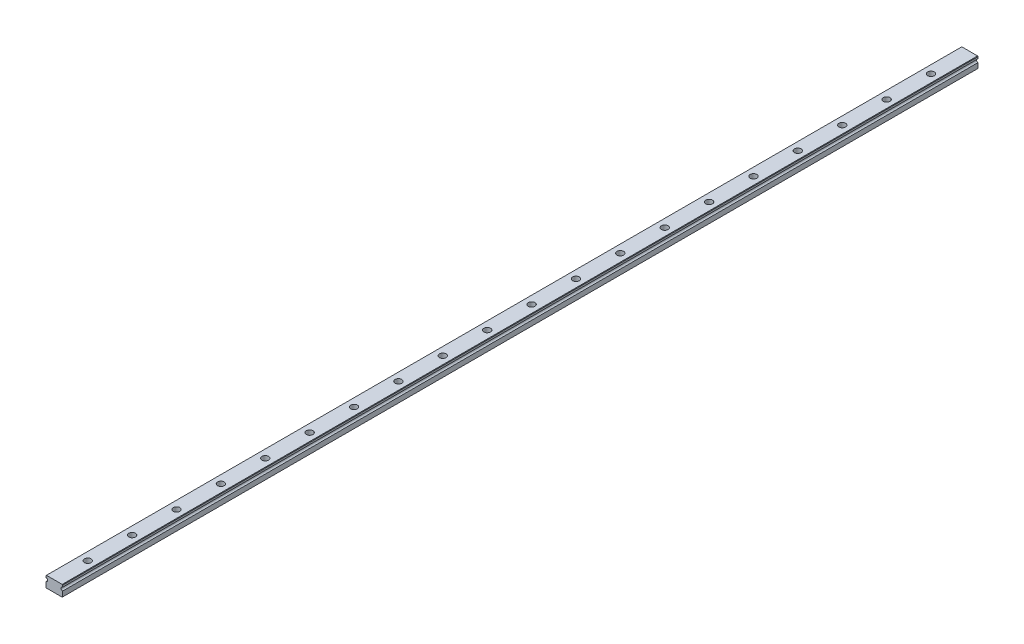
from build123d import *

# Parameters (mm, degrees)
EXTRUDE_1_DEPTH        = 1000
SKETCH_2_R             = 1.5
CUT_EXTRUDE_1_DEPTH    = 20
SKETCH_3_R             = 3
CUT_EXTRUDE_2_DEPTH    = 4.5
PATTERN_LINEAR_1_COUNT = 25
PATTERN_LINEAR_1_PITCH = 40
CUT_EXTRUDE_4_DEPTH    = 80
CUT_EXTRUDE_5_DEPTH    = 80
EXTRUDE_START          = 15
EXTRUDE_2_DEPTH        = 15
CUT_EXTRUDE_START      = -30
CUT_EXTRUDE_8_DEPTH    = 30


with BuildPart() as part:
    # 草图1 → 凸台-拉伸1 (new body)
    with BuildSketch(Plane.XY):
        with BuildLine():
            Line((-7.643186957, 0.234233912), (-7.643186957, -4.365766088))
            Line((-7.643186957, -4.365766088), (-7.243186957, -4.765766088))
            Line((-7.243186957, -4.765766088), (6.956813043, -4.765766088))
            Line((6.956813043, -4.765766088), (7.356813043, -4.365766088))
            Line((7.356813043, -4.365766088), (7.356813043, 0.234233912))
            ThreePointArc((7.356813043, 0.234233912), (6.296152871, 0.67357374), (5.856813043, 1.734233912))
            ThreePointArc((5.856813043, 1.734233912), (6.296152871, 2.794894084), (7.356813043, 3.234233912))
            Line((7.356813043, 3.234233912), (7.356813043, 4.834233912))
            Line((7.356813043, 4.834233912), (6.956813043, 5.234233912))
            Line((6.956813043, 5.234233912), (-7.243186957, 5.234233912))
            Line((-7.243186957, 5.234233912), (-7.643186957, 4.834233912))
            Line((-7.643186957, 4.834233912), (-7.643186957, 3.234233912))
            ThreePointArc((-7.643186957, 3.234233912), (-6.143186957, 1.734233912), (-7.643186957, 0.234233912))
        make_face()
    extrude(amount=EXTRUDE_1_DEPTH)

    # 草图2 → 切除-拉伸1 (cut)
    with BuildSketch(Plane(origin=(0, 5.234233912, 0), x_dir=(1, 0, 0), z_dir=(0, 1, 0))):
        with Locations((0, -20)):
            Circle(SKETCH_2_R)
    cut_extrude_1 = extrude(amount=-CUT_EXTRUDE_1_DEPTH, mode=Mode.SUBTRACT)

    # 草图3 → 切除-拉伸2 (cut)
    with BuildSketch(Plane(origin=(0, 5.234233912, 0), x_dir=(1, 0, 0), z_dir=(0, 1, 0))):
        with Locations((0, -20)):
            Circle(SKETCH_3_R)
    cut_extrude_2 = extrude(amount=-CUT_EXTRUDE_2_DEPTH, mode=Mode.SUBTRACT)

    # 阵列(线性)1: 切除-拉伸1, 切除-拉伸2 ×25
    with Locations(*[(0, 0, i * PATTERN_LINEAR_1_PITCH) for i in range(1, PATTERN_LINEAR_1_COUNT)]):
        add(cut_extrude_1, mode=Mode.SUBTRACT)
        add(cut_extrude_2, mode=Mode.SUBTRACT)

    # 草图6 → 切除-拉伸4 (cut)
    with BuildSketch(Plane(origin=(0, 0, 0), x_dir=(-1, 0, 0), z_dir=(0, 0, -1))):
        with BuildLine():
            Line((7.643186957, 3.234233912), (7.643186957, 4.834233912))
            Line((7.643186957, 4.834233912), (7.243186957, 5.234233912))
            Line((7.243186957, 5.234233912), (-6.956813043, 5.234233912))
            Line((-6.956813043, 5.234233912), (-7.356813043, 4.834233912))
            Line((-7.356813043, 4.834233912), (-7.356813043, 3.234233912))
            ThreePointArc((-7.356813043, 3.234233912), (-5.856813043, 1.734233912), (-7.356813043, 0.234233912))
            Line((-7.356813043, 0.234233912), (-7.356813043, -4.365766088))
            Line((-7.356813043, -4.365766088), (-6.956813043, -4.765766088))
            Line((-6.956813043, -4.765766088), (7.243186957, -4.765766088))
            Line((7.243186957, -4.765766088), (7.643186957, -4.365766088))
            Line((7.643186957, -4.365766088), (7.643186957, 0.234233912))
            ThreePointArc((7.643186957, 0.234233912), (6.143186957, 1.734233912), (7.643186957, 3.234233912))
        make_face()
    extrude(amount=-CUT_EXTRUDE_4_DEPTH, mode=Mode.SUBTRACT)

    # 草图7 → 切除-拉伸5 (cut)
    with BuildSketch(Plane(origin=(0, 0, 80), x_dir=(-1, 0, 0), z_dir=(0, 0, -1))):
        with BuildLine():
            Line((7.643186957, 3.234233912), (7.643186957, 4.834233912))
            Line((7.643186957, 4.834233912), (7.243186957, 5.234233912))
            Line((7.243186957, 5.234233912), (-6.956813043, 5.234233912))
            Line((-6.956813043, 5.234233912), (-7.356813043, 4.834233912))
            Line((-7.356813043, 4.834233912), (-7.356813043, 3.234233912))
            ThreePointArc((-7.356813043, 3.234233912), (-5.856813043, 1.734233912), (-7.356813043, 0.234233912))
            Line((-7.356813043, 0.234233912), (-7.356813043, -4.365766088))
            Line((-7.356813043, -4.365766088), (-6.956813043, -4.765766088))
            Line((-6.956813043, -4.765766088), (7.243186957, -4.765766088))
            Line((7.243186957, -4.765766088), (7.643186957, -4.365766088))
            Line((7.643186957, -4.365766088), (7.643186957, 0.234233912))
            ThreePointArc((7.643186957, 0.234233912), (6.143186957, 1.734233912), (7.643186957, 3.234233912))
        make_face()
    extrude(amount=-CUT_EXTRUDE_5_DEPTH, mode=Mode.SUBTRACT)

    # 草图10 → 凸台-拉伸2 (add)
    with BuildSketch(Plane(origin=(0, 0, 160), x_dir=(-1, 0, 0), z_dir=(0, 0, -1)).offset(EXTRUDE_START)):
        with BuildLine():
            Line((7.643186957, 3.234233912), (7.643186957, 4.834233912))
            Line((7.643186957, 4.834233912), (7.243186957, 5.234233912))
            Line((7.243186957, 5.234233912), (-6.956813043, 5.234233912))
            Line((-6.956813043, 5.234233912), (-7.356813043, 4.834233912))
            Line((-7.356813043, 4.834233912), (-7.356813043, 3.234233912))
            ThreePointArc((-7.356813043, 3.234233912), (-5.856813043, 1.734233912), (-7.356813043, 0.234233912))
            Line((-7.356813043, 0.234233912), (-7.356813043, -4.365766088))
            Line((-7.356813043, -4.365766088), (-6.956813043, -4.765766088))
            Line((-6.956813043, -4.765766088), (7.243186957, -4.765766088))
            Line((7.243186957, -4.765766088), (7.643186957, -4.365766088))
            Line((7.643186957, -4.365766088), (7.643186957, 0.234233912))
            ThreePointArc((7.643186957, 0.234233912), (6.143186957, 1.734233912), (7.643186957, 3.234233912))
        make_face()
    extrude(amount=-EXTRUDE_2_DEPTH)

    # 草图11 → 切除-拉伸8 (cut)
    with BuildSketch(Plane.XY.offset(1000).offset(CUT_EXTRUDE_START)):
        with BuildLine():
            Line((-7.643186957, 0.234233912), (-7.643186957, -4.365766088))
            Line((-7.643186957, -4.365766088), (-7.243186957, -4.765766088))
            Line((-7.243186957, -4.765766088), (6.956813043, -4.765766088))
            Line((6.956813043, -4.765766088), (7.356813043, -4.365766088))
            Line((7.356813043, -4.365766088), (7.356813043, 0.234233912))
            ThreePointArc((7.356813043, 0.234233912), (5.856813043, 1.734233912), (7.356813043, 3.234233912))
            Line((7.356813043, 3.234233912), (7.356813043, 4.834233912))
            Line((7.356813043, 4.834233912), (6.956813043, 5.234233912))
            Line((6.956813043, 5.234233912), (-7.243186957, 5.234233912))
            Line((-7.243186957, 5.234233912), (-7.643186957, 4.834233912))
            Line((-7.643186957, 4.834233912), (-7.643186957, 3.234233912))
            ThreePointArc((-7.643186957, 3.234233912), (-6.143186957, 1.734233912), (-7.643186957, 0.234233912))
        make_face()
    extrude(amount=CUT_EXTRUDE_8_DEPTH, mode=Mode.SUBTRACT)


solid = part.part
